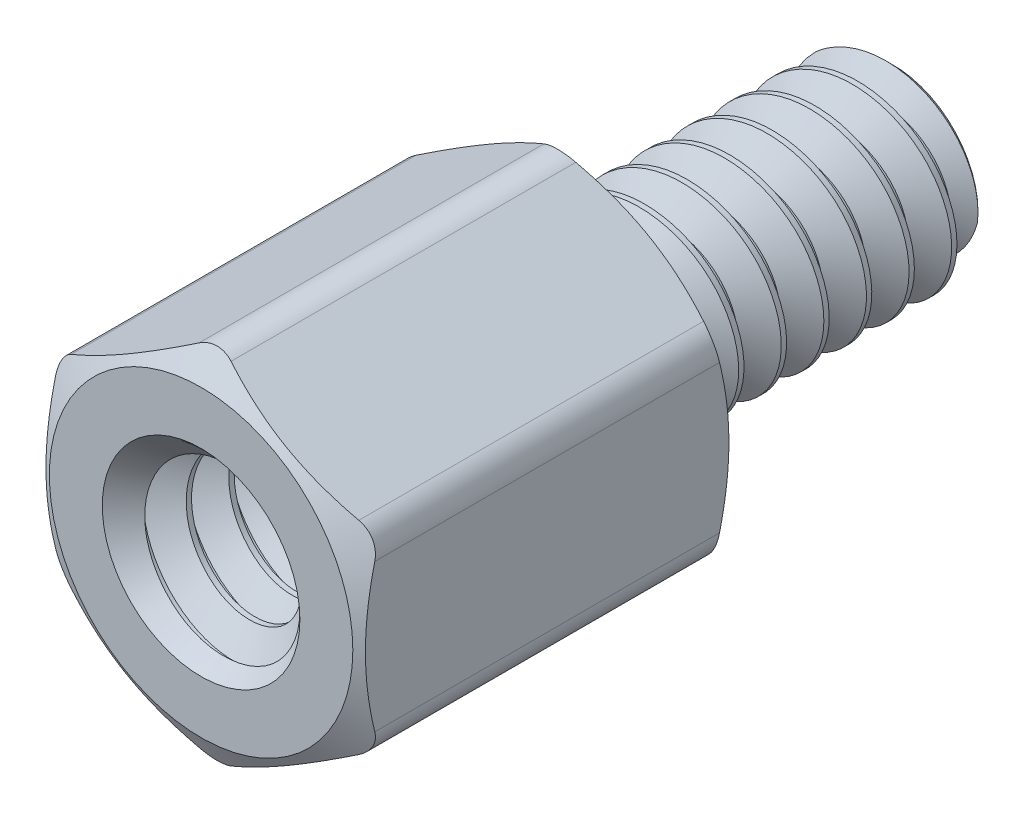
from build123d import *

# Parameters (mm, degrees)
SKETCH4_R           = 1.901825
BOSS_EXTRUDE1_DEPTH = 5.55625
SKETCH5_OUTSIDE_W   = 50.652
SKETCH5_OUTSIDE_H   = 51.39
SKETCH5_OUTSIDE_R   = 2.2621875
CUT_EXTRUDE1_DEPTH  = 11.941088697
CUT_EXTRUDE1_DRAFT  = -60
SKETCH6_OUTSIDE_W   = 35.756
SKETCH6_OUTSIDE_H   = 36.494
SKETCH6_OUTSIDE_R   = 2.2621875
CUT_EXTRUDE2_DEPTH  = 7.640988961
CUT_EXTRUDE2_DRAFT  = -60
FILLET1_R           = 0.47625
CUT_SWEEP1_PITCH    = 0.635
SKETCH9_R           = 1.58115
BOSS_EXTRUDE2_DEPTH = 3.175
SKETCH10_W          = 3.175
SKETCH10_H          = 1.4224
CUT_SWEEP2_PITCH    = 0.635


with BuildPart() as part:
    # Sketch3 → Revolve1 (revolve)
    with BuildSketch(Plane(origin=(0, 0, 0), x_dir=(0, 0, -1), z_dir=(1, 0, 0))):
        with BuildLine():
            Line((-2.38125, 1.26365), (-2.38125, 0))
            Line((-2.38125, 0), (4.7625, 0))
            Line((4.7625, 0), (4.7625, 1.26365))
            Line((4.7625, 1.26365), (4.60375, 1.4224))
            Line((4.60375, 1.4224), (0.809625, 1.4224))
            Line((0.809625, 1.4224), (0.5715, 1.009955401))
            Line((0.5715, 1.009955401), (0.15875, 1.009955401))
            ThreePointArc((0.15875, 1.009955401), (0.046496798, 1.0564522), (0, 1.168705401))
            Line((0, 1.168705401), (0, 2.38125))
            Line((0, 2.38125), (-5.55625, 2.38125))
            Line((-5.55625, 2.38125), (-5.55625, 1.58115))
            Line((-5.55625, 1.58115), (-5.3975, 1.4224))
            Line((-5.3975, 1.4224), (-2.54, 1.4224))
            Line((-2.54, 1.4224), (-2.38125, 1.26365))
        make_face()
    revolve(axis=Axis((0, 0, -4.7625), (0, 0, 1)))

    # Sketch4 → Boss-Extrude1 (add)
    with BuildSketch(Plane.XY.offset(5.55625)):
        Polygon((-2.38125, 1.374815329), (-2.38125, -1.374815329), (0, -2.749630657), (2.38125, -1.374815329), (2.38125, 1.374815329), (0, 2.749630657), align=None)
        Circle(SKETCH4_R, mode=Mode.SUBTRACT)
    extrude(amount=-BOSS_EXTRUDE1_DEPTH)


with BuildPart() as cut_extrude1_tool:
    # Sketch5 outside → Cut-Extrude1 (with draft: the straight prism first)
    with BuildSketch(Plane.XY.offset(5.55625)):
        Rectangle(SKETCH5_OUTSIDE_W, SKETCH5_OUTSIDE_H)
        Circle(SKETCH5_OUTSIDE_R, mode=Mode.SUBTRACT)
    extrude(amount=-CUT_EXTRUDE1_DEPTH)
    # Cut-Extrude1: the draft: its side faces are tilted about the plane it starts from
    cut_extrude1_sides = [cut_extrude1_tool.faces().sort_by_distance(p)[0] for p in [
        (0, -25.695, -0.414294348),
        (25.326, 0, -0.414294348),
        (0, 25.695, -0.414294348),
        (-25.326, 0, -0.414294348),
        (-2.2621875, 0, -0.414294348),
    ]]
    draft(cut_extrude1_sides, Plane.XY.offset(5.55625), CUT_EXTRUDE1_DRAFT)


with BuildPart() as part_1:
    add(part.part)

    # Cut-Extrude1: cut by cut_extrude1_tool
    add(cut_extrude1_tool.part, mode=Mode.SUBTRACT)


with BuildPart() as cut_extrude2_tool:
    # Sketch6 outside → Cut-Extrude2 (with draft: the straight prism first)
    with BuildSketch(Plane(origin=(0, 0, 0), x_dir=(-1, 0, 0), z_dir=(0, 0, -1))):
        Rectangle(SKETCH6_OUTSIDE_W, SKETCH6_OUTSIDE_H)
        Circle(SKETCH6_OUTSIDE_R, mode=Mode.SUBTRACT)
    extrude(amount=-CUT_EXTRUDE2_DEPTH)
    # Cut-Extrude2: the draft: its side faces are tilted about the plane it starts from
    cut_extrude2_sides = [cut_extrude2_tool.faces().sort_by_distance(p)[0] for p in [
        (0, -18.247, 3.82049448),
        (-17.878, 0, 3.82049448),
        (0, 18.247, 3.82049448),
        (17.878, 0, 3.82049448),
        (2.2621875, 0, 3.82049448),
    ]]
    draft(cut_extrude2_sides, Plane(origin=(0, 0, 0), x_dir=(-1, 0, 0), z_dir=(0, 0, -1)), CUT_EXTRUDE2_DRAFT)


with BuildPart() as part_2:
    add(part_1.part)

    # Cut-Extrude2: cut by cut_extrude2_tool
    add(cut_extrude2_tool.part, mode=Mode.SUBTRACT)

    # Fillet1
    fillet1_edges = [part_2.edges().sort_by_distance(p)[0] for p in [
        (0, 2.749630657, 2.778125),
        (-2.38125, -1.374815329, 2.778125),
        (0, -2.749630657, 2.778125),
        (2.38125, -1.374815329, 2.778125),
        (2.38125, 1.374815329, 2.778125),
        (-2.38125, 1.374815329, 2.778125),
    ]]
    fillet(fillet1_edges, radius=FILLET1_R)

    # Cut-Sweep1: the profile of Sketch7 profile screwed along a right-hand helix of 7.275 turns, 6 arcs to a turn; built about Z, then put on its axis
    cut_sweep1_z = Axis((0, 0, 0), (0, 0, 1))
    cut_sweep1_corners = [(1.009655401, 0, -0.238298205), (1.009655401, 0, -0.317326795), (1.456770383, 0, -0.57546875), (1.456770383, 0, 0.01984375)]
    with BuildLine(mode=Mode.PRIVATE) as cut_sweep1_profile:
        Line(cut_sweep1_corners[0], cut_sweep1_corners[1])
        Line(cut_sweep1_corners[1], cut_sweep1_corners[2])
        Line(cut_sweep1_corners[2], cut_sweep1_corners[3])
        Line(cut_sweep1_corners[3], cut_sweep1_corners[0])
    cut_sweep1_cap = Face(cut_sweep1_profile.wire())
    cut_sweep1_turn_angles = [0, 30, 60, 90, 120, 150, 180, 210, 240, 270, 300, 330, 360]
    cut_sweep1_turn_weights = [1, 0.8660254037844387, 1, 0.8660254037844387, 1, 0.8660254037844387, 1, 0.8660254037844387, 1, 0.8660254037844387, 1, 0.8660254037844387, 1]
    cut_sweep1_turn_rails = [Edge.make_bspline([Vector(p[0], p[1], 0).rotate(cut_sweep1_z, cut_sweep1_turn_angles[k]) / cut_sweep1_turn_weights[k] + Vector(0, 0, p[2] + CUT_SWEEP1_PITCH * cut_sweep1_turn_angles[k] / 360) for k in range(13)], [0, 0, 0, 1, 1, 2, 2, 3, 3, 4, 4, 5, 5, 6, 6, 6], 2, cut_sweep1_turn_weights) for p in cut_sweep1_corners]
    cut_sweep1_turn_sides = [Face.make_surface_from_curves(cut_sweep1_turn_rails[p[0]], cut_sweep1_turn_rails[p[1]]) for p in [(0, 1), (1, 2), (2, 3), (3, 0)]]
    cut_sweep1_last_angles = [2520, 2550, 2580, 2599.5, 2619]
    cut_sweep1_last_weights = [1, 0.8660254037844387, 1, 0.9426414910921784, 1]
    cut_sweep1_last_rails = [Edge.make_bspline([Vector(p[0], p[1], 0).rotate(cut_sweep1_z, cut_sweep1_last_angles[k]) / cut_sweep1_last_weights[k] + Vector(0, 0, p[2] + CUT_SWEEP1_PITCH * cut_sweep1_last_angles[k] / 360) for k in range(5)], [0, 0, 0, 1, 1, 2, 2, 2], 2, cut_sweep1_last_weights) for p in cut_sweep1_corners]
    cut_sweep1_last_sides = [Face.make_surface_from_curves(cut_sweep1_last_rails[p[0]], cut_sweep1_last_rails[p[1]]) for p in [(0, 1), (1, 2), (2, 3), (3, 0)]]
    cut_sweep1 = Plane(origin=(0, 0, -4.7625), x_dir=(0, 1, 0), z_dir=(0, 0, 1)) * Solid(Shell([*[p.moved(Location((0, 0, CUT_SWEEP1_PITCH * i))) for i in range(7) for p in cut_sweep1_turn_sides], *cut_sweep1_last_sides, cut_sweep1_cap, cut_sweep1_cap.rotate(cut_sweep1_z, 2619).moved(Location((0, 0, CUT_SWEEP1_PITCH * 2619 / 360)))]))
    add(cut_sweep1, mode=Mode.SUBTRACT)

    # Sketch9 → Boss-Extrude2 (add)
    with BuildSketch(Plane.XY.offset(2.38125)):
        Circle(SKETCH9_R)
    extrude(amount=BOSS_EXTRUDE2_DEPTH)


with BuildPart() as body_2:
    # Sketch10 → Revolve2 (revolve)
    with BuildSketch(Plane(origin=(0, 0, 0), x_dir=(0, 0, -1), z_dir=(1, 0, 0))):
        with Locations((-3.96875, 0.7112)):
            Rectangle(SKETCH10_W, SKETCH10_H)
    revolve(axis=Axis((0, 0, -4.7625), (0, 0, 1)))

    # Cut-Sweep2: the profile of Sketch12 profile screwed along a right-hand helix of 6 turns, 6 arcs to a turn; built about Z, then put on its axis
    cut_sweep2_z = Axis((0, 0, 0), (0, 0, 1))
    cut_sweep2_corners = [(1.009655401, 0, -0.317326795), (1.009655401, 0, -0.238298205), (1.456770383, 0, 0.01984375), (1.456770383, 0, -0.57546875)]
    with BuildLine(mode=Mode.PRIVATE) as cut_sweep2_profile:
        Line(cut_sweep2_corners[0], cut_sweep2_corners[1])
        Line(cut_sweep2_corners[1], cut_sweep2_corners[2])
        Line(cut_sweep2_corners[2], cut_sweep2_corners[3])
        Line(cut_sweep2_corners[3], cut_sweep2_corners[0])
    cut_sweep2_cap = Face(cut_sweep2_profile.wire())
    cut_sweep2_turn_angles = [0, 30, 60, 90, 120, 150, 180, 210, 240, 270, 300, 330, 360]
    cut_sweep2_turn_weights = [1, 0.8660254037844387, 1, 0.8660254037844387, 1, 0.8660254037844387, 1, 0.8660254037844387, 1, 0.8660254037844387, 1, 0.8660254037844387, 1]
    cut_sweep2_turn_rails = [Edge.make_bspline([Vector(p[0], p[1], 0).rotate(cut_sweep2_z, cut_sweep2_turn_angles[k]) / cut_sweep2_turn_weights[k] + Vector(0, 0, p[2] + CUT_SWEEP2_PITCH * cut_sweep2_turn_angles[k] / 360) for k in range(13)], [0, 0, 0, 1, 1, 2, 2, 3, 3, 4, 4, 5, 5, 6, 6, 6], 2, cut_sweep2_turn_weights) for p in cut_sweep2_corners]
    cut_sweep2_turn_sides = [Face.make_surface_from_curves(cut_sweep2_turn_rails[p[0]], cut_sweep2_turn_rails[p[1]]) for p in [(0, 1), (1, 2), (2, 3), (3, 0)]]
    cut_sweep2 = Plane(origin=(0, 0, 5.55625), x_dir=(0, 1, 0), z_dir=(0, 0, -1)) * Solid(Shell([*[p.moved(Location((0, 0, CUT_SWEEP2_PITCH * i))) for i in range(6) for p in cut_sweep2_turn_sides], cut_sweep2_cap, cut_sweep2_cap.rotate(cut_sweep2_z, 2160).moved(Location((0, 0, CUT_SWEEP2_PITCH * 2160 / 360)))]))
    add(cut_sweep2, mode=Mode.SUBTRACT)


with BuildPart() as part_3:
    add(part_2.part)

    # Combine1: cut body 2
    add(body_2.part, mode=Mode.SUBTRACT)

    # Cut-Extrude3 cone 1 section (through the dimple's axis) → Cut-Extrude3 (revolve, cut)
    with BuildSketch(Plane(origin=(0, 0, 5.55625), x_dir=(0, -1, 0), z_dir=(1, 0, 0))):
        Polygon((0, 0), (1.4732, 0), (0, 1.4732), align=None)
    revolve(axis=Axis((0, 0, 5.55625), (0, 0, -1)), mode=Mode.SUBTRACT)


solid = part_3.part
